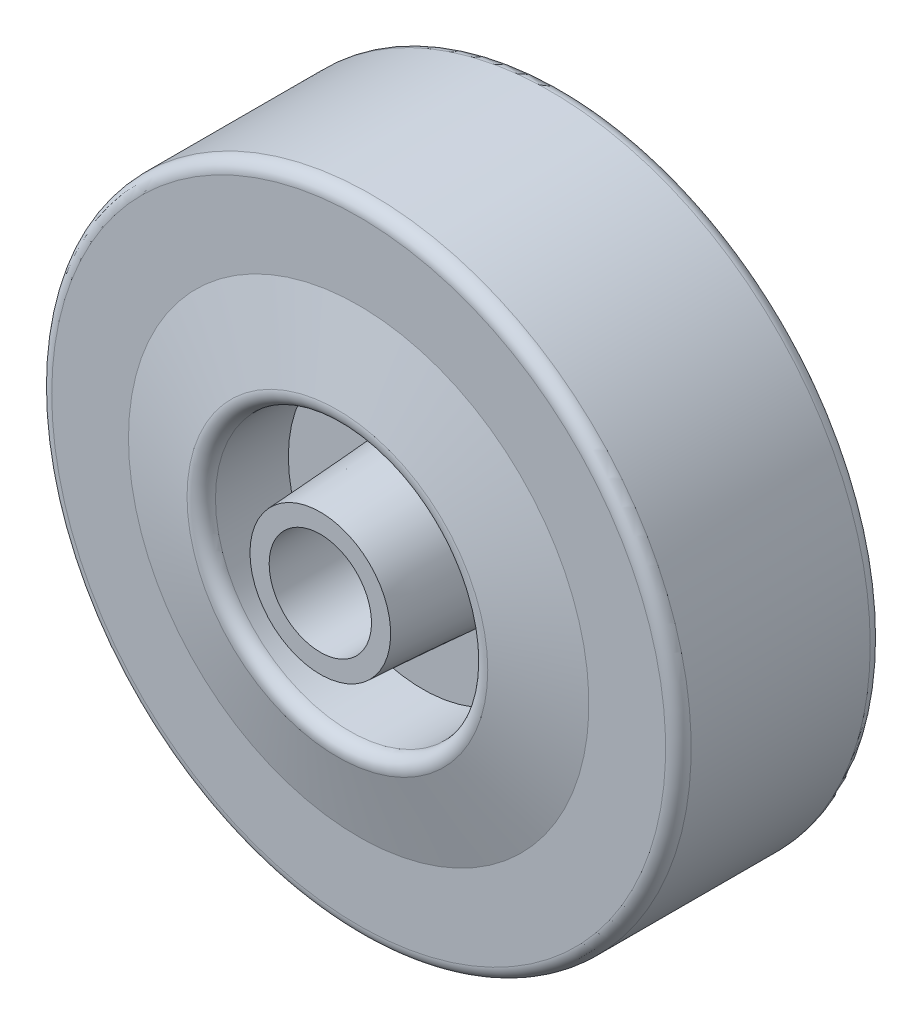
from build123d import *

# Parameters (mm, degrees)
CONG_1_R = 1
CONG_2_R = 1


with BuildPart() as part:
    # Esquisse1 → Révolution1 (revolve)
    with BuildSketch(Plane(origin=(0, 0, 0), x_dir=(1, 0, 0), z_dir=(0, 1, 0))):
        Polygon((4, -11), (4, 11), (5.5, 11), (6, 3), (10.5, 3), (10.5, 10), (18, 8), (25, 8), (25, -8), (18, -8), (10.5, -10), (10.5, -3), (6, -3), (5.5, -11), align=None)
    revolve(axis=Axis((0, 0, -12.605103239), (0, 0, 1)))

    # Congé1
    cong_1_edges = [part.edges().sort_by_distance(p)[0] for p in [
        (-25, 0, 8),
        (-25, 0, -8),
    ]]
    fillet(cong_1_edges, radius=CONG_1_R)

    # Congé2
    cong_2_edges = [part.edges().sort_by_distance(p)[0] for p in [
        (-10.5, 0, -10),
        (-10.5, 0, 10),
    ]]
    fillet(cong_2_edges, radius=CONG_2_R)


solid = part.part
